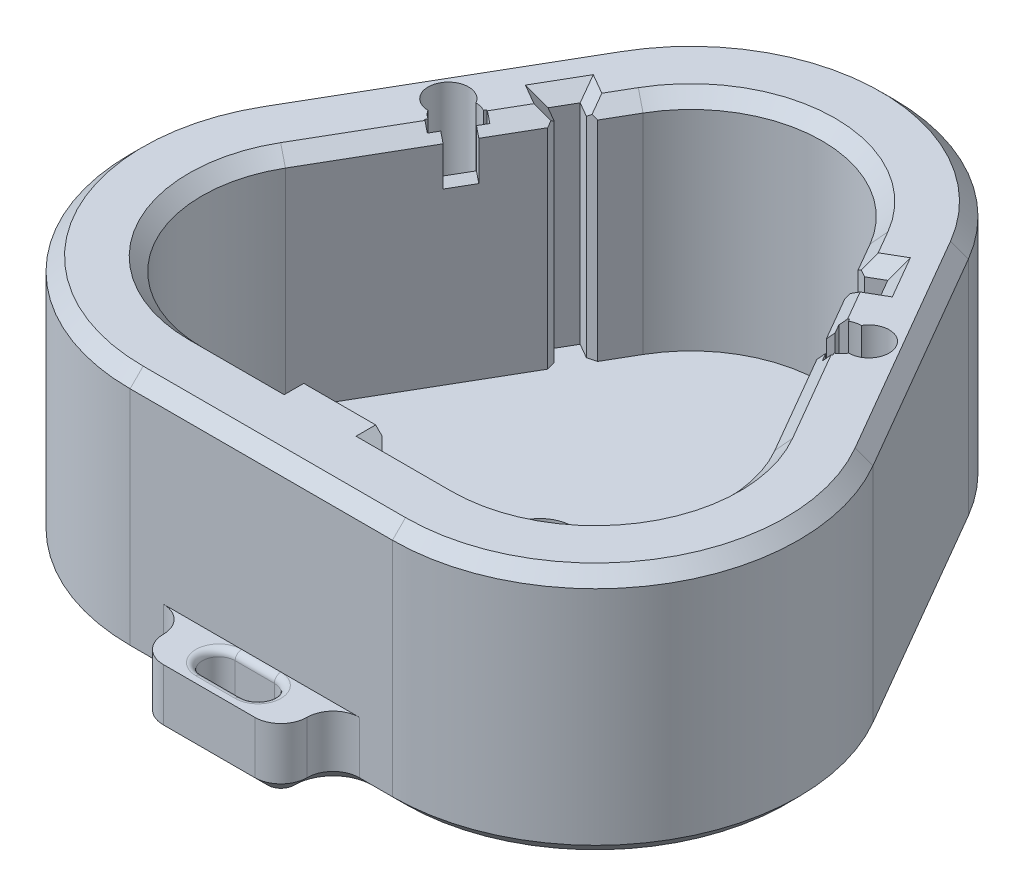
from build123d import *
from build123d.topology import SkipClean

# Parameters (mm, degrees)
BOSS_EXTRUDE1_DEPTH = 17
CHAMFER1_SIZE       = 0.5
BOSS_EXTRUDE2_START = -2
SKETCH1_4_R         = 1.55
BOSS_EXTRUDE2_DEPTH = 2
CUT_EXTRUDE2_REACH  = 43.817
SKETCH2_R           = 2.5
SKETCH2_2_W         = 11
SKETCH2_2_H         = 4
BOSS_EXTRUDE3_DEPTH = 5
FILLET1_R           = 2
FILLET2_R           = 0.5
CHAMFER4_SIZE       = 1
CUT_EXTRUDE3_DEPTH  = 3
CHAMFER5_SIZE       = 1
CHAMFER6_SIZE       = 0.5


# Some blends are built 0.0001 mm under size
with BuildPart() as part:
    # Sketch1 → Boss-Extrude1 (new body)
    with BuildSketch(Plane(origin=(0, 0, 0), x_dir=(1, 0, 0), z_dir=(0, 1, 0))):
        with BuildLine():
            ThreePointArc((13.443940814, 19.338496226), (0, 27.087942695), (-13.443940814, 19.338496226))
            Line((-13.443940814, 19.338496226), (-23.480112729, 2.010840056))
            ThreePointArc((-23.480112729, 2.010840056), (-23.496271152, -13.534646006), (-10.036171915, -21.312057305))
            Line((-10.036171915, -21.312057305), (10.036171915, -21.312057305))
            ThreePointArc((10.036171915, -21.312057305), (23.496271152, -13.534646006), (23.480112729, 2.010840056))
            Line((23.480112729, 2.010840056), (13.443940814, 19.338496226))
        make_face()
        with BuildLine():
            Line((-3.75, -15.312057305), (-3.75, -15.812057305))
            Line((-3.75, -15.812057305), (-10.036171915, -15.812057305))
            ThreePointArc((-10.036171915, -15.812057305), (-18.731226957, -10.787947294), (-18.720788818, -0.745758557))
            Line((-18.720788818, -0.745758557), (-11.1108823, 12.392900759))
            Line((-11.1108823, 12.392900759), (-12.668479216, 13.295060305))
            Line((-12.668479216, 13.295060305), (-11.76631967, 14.852657222))
            Line((-11.76631967, 14.852657222), (-10.208722754, 13.950497676))
            Line((-10.208722754, 13.950497676), (-8.684616903, 16.581897613))
            ThreePointArc((-8.684616903, 16.581897613), (0, 21.587942695), (8.684616903, 16.581897613))
            Line((8.684616903, 16.581897613), (10.208722754, 13.950497676))
            Line((10.208722754, 13.950497676), (11.76631967, 14.852657222))
            Line((11.76631967, 14.852657222), (12.668479216, 13.295060305))
            Line((12.668479216, 13.295060305), (11.1108823, 12.392900759))
            Line((11.1108823, 12.392900759), (18.720788818, -0.745758557))
            ThreePointArc((18.720788818, -0.745758557), (18.731226957, -10.787947294), (10.036171915, -15.812057305))
            Line((10.036171915, -15.812057305), (3.75, -15.812057305))
            Line((3.75, -15.812057305), (3.75, -15.312057305))
            Line((3.75, -15.312057305), (-3.75, -15.312057305))
        make_face(mode=Mode.SUBTRACT)
        with BuildLine():
            Line((-13.869325554, 9.825125784), (-13.350126582, 9.524405935))
            Line((-13.350126582, 9.524405935), (-15.104325699, 6.495745265))
            Line((-15.104325699, 6.495745265), (-15.623524672, 6.796465113))
            Line((-15.623524672, 6.796465113), (-15.523284722, 6.969531437))
            ThreePointArc((-15.523284722, 6.969531437), (-15.843958543, 7.216299963), (-16.089837275, 7.537656546))
            ThreePointArc((-16.089837275, 7.537656546), (-17.428953135, 9.864514667), (-14.744276962, 9.86079396))
            ThreePointArc((-14.744276962, 9.86079396), (-14.343181024, 9.807423059), (-13.969565504, 9.65205946))
            Line((-13.969565504, 9.65205946), (-13.869325554, 9.825125784))
        make_face(mode=Mode.SUBTRACT)
        with BuildLine():
            Line((13.869325554, 9.825125784), (13.969565504, 9.65205946))
            ThreePointArc((13.969565504, 9.65205946), (14.343181024, 9.807423059), (14.744276962, 9.86079396))
            ThreePointArc((14.744276962, 9.86079396), (17.428953135, 9.864514667), (16.089837275, 7.537656546))
            ThreePointArc((16.089837275, 7.537656546), (15.843958543, 7.216299963), (15.523284722, 6.969531437))
            Line((15.523284722, 6.969531437), (15.623524672, 6.796465113))
            Line((15.623524672, 6.796465113), (15.104325699, 6.495745265))
            Line((15.104325699, 6.495745265), (13.350126582, 9.524405935))
            Line((13.350126582, 9.524405935), (13.869325554, 9.825125784))
        make_face(mode=Mode.SUBTRACT)
    extrude(amount=BOSS_EXTRUDE1_DEPTH)

    # Chamfer1
    chamfer1_edges = [part.edges().sort_by_distance(p)[0] for p in [
        (-10.208722754, 8.5, -13.950497676),
        (-11.1108823, 8.5, -12.392900759),
        (11.1108823, 8.5, -12.392900759),
        (10.208722754, 8.5, -13.950497676),
    ]]
    chamfer(chamfer1_edges, length=CHAMFER1_SIZE)

    # Sketch1<4> → Boss-Extrude2 (add)
    with SkipClean():  # the faces are left unmerged after this step: merging them gives an invalid solid
        with BuildSketch(Plane(origin=(0, 0, 0), x_dir=(1, 0, 0), z_dir=(0, 1, 0)).offset(BOSS_EXTRUDE2_START)):
            with BuildLine():
                ThreePointArc((13.443940814, 19.338496226), (0, 27.087942695), (-13.443940814, 19.338496226))
                Line((-13.443940814, 19.338496226), (-23.480112729, 2.010840056))
                ThreePointArc((-23.480112729, 2.010840056), (-23.496271152, -13.534646006), (-10.036171915, -21.312057305))
                Line((-10.036171915, -21.312057305), (10.036171915, -21.312057305))
                ThreePointArc((10.036171915, -21.312057305), (23.496271152, -13.534646006), (23.480112729, 2.010840056))
                Line((23.480112729, 2.010840056), (13.443940814, 19.338496226))
            make_face()
            with Locations(Location((-16.087689124, 9.087655058, 0), (0, 0, 29.920593528))):
                Circle(SKETCH1_4_R, mode=Mode.SUBTRACT)
            with Locations(Location((16.087689124, 9.087655058, 0), (0, 0, 150.079406472))):
                Circle(SKETCH1_4_R, mode=Mode.SUBTRACT)
        extrude(amount=BOSS_EXTRUDE2_DEPTH)

    # Sketch2 → Cut-Extrude2 (cut, up to next)
    with BuildSketch(Plane.XZ.offset(2), mode=Mode.PRIVATE) as cut_extrude2_sk1:
        with Locations(Location((0, 0, 0), (0, 0, 270))):
            Circle(SKETCH2_R)
    cut_extrude2_tool1 = extrude(cut_extrude2_sk1.sketch, amount=-CUT_EXTRUDE2_REACH, mode=Mode.PRIVATE) & part.part
    add(cut_extrude2_tool1.solids().sort_by_distance((0, -2, 0))[0], mode=Mode.SUBTRACT)

    # Sketch2<2> → Boss-Extrude3 (add)
    with SkipClean():  # the faces are left unmerged after this step: merging them gives an invalid solid
        with BuildSketch(Plane.XZ.offset(2)):
            with Locations((0, 23.312057305)):
                Rectangle(SKETCH2_2_W, SKETCH2_2_H)
            with BuildLine():
                ThreePointArc((-1.5, 21.812057305), (-2.75, 23.062057305), (-1.5, 24.312057305))
                Line((-1.5, 24.312057305), (1.5, 24.312057305))
                ThreePointArc((1.5, 24.312057305), (2.75, 23.062057305), (1.5, 21.812057305))
                Line((1.5, 21.812057305), (-1.5, 21.812057305))
            make_face(mode=Mode.SUBTRACT)
        extrude(amount=-BOSS_EXTRUDE3_DEPTH)

    # Fillet1
    fillet1_edges = [part.edges().sort_by_distance(p)[0] for p in [
        (5.5, 1.5, 21.312057305),
        (-5.5, 1.5, 21.312057305),
        (-5.5, -1, 21.312057305),
        (5.5, -1, 21.312057305),
    ]]
    fillet(fillet1_edges, radius=FILLET1_R)
    fillet1_2_edges = [part.edges().sort_by_distance(p)[0] for p in [
        (5.5, 0.5, 25.312057305),
        (-5.5, 0.5, 25.312057305),
    ]]
    fillet(fillet1_2_edges, radius=FILLET1_R - 0.0001)  # a hair under: the kernel refuses the full size

    # Fillet2
    fillet2_edges = [part.edges().sort_by_distance(p)[0] for p in [
        (0, 3, 24.312057305),
        (2.75, 3, 23.062057305),
        (-2.75, 3, 23.062057305),
        (0, 3, 21.812057305),
    ]]
    fillet(fillet2_edges, radius=FILLET2_R - 0.0001)  # a hair under: the kernel refuses the full size

    # Chamfer4
    chamfer4_edges = [part.edges().sort_by_distance(p)[0] for p in [
        (0, -2, -27.087942695),
        (23.496271152, -2, 13.534646006),
        (-8.768085957, -2, 21.312057305),
        (-23.496271152, -2, 13.534646006),
        (-18.462026771, -2, -10.674668141),
        (18.462026771, -2, -10.674668141),
        (0, 17, 21.312057305),
        (23.496271152, 17, 13.534646006),
        (18.462026771, 17, -10.674668141),
        (0, 17, -27.087942695),
        (-18.462026771, 17, -10.674668141),
        (-23.496271152, 17, 13.534646006),
        (8.768085958, -2, 21.312057305),
        (0, -2, 25.312057305),
        (-4.914242852, -2, 24.726300157),
        (4.914242852, -2, 24.726300157),
        (6.085786438, -2, 21.897843743),
        (-6.085786438, -2, 21.897843743),
    ]]
    chamfer(chamfer4_edges, length=CHAMFER4_SIZE - 0.0001)  # a hair under: the kernel refuses the full size

    # Sketch3 → Cut-Extrude3 (cut)
    with SkipClean():  # the faces are left unmerged after this step: merging them gives an invalid solid
        with BuildSketch(Plane(origin=(0, 17, 0), x_dir=(1, 0, 0), z_dir=(0, 1, 0))):
            Polygon((-13.726026393, 8.87540722), (-13.293360583, 8.624807346), (-14.295760079, 6.894144106), (-14.728425889, 7.14474398), align=None)
            Polygon((14.728425889, 7.14474398), (13.726026393, 8.87540722), (13.293360583, 8.624807346), (14.295760079, 6.894144106), align=None)
        extrude(amount=-CUT_EXTRUDE3_DEPTH, mode=Mode.SUBTRACT)

    # Chamfer5
    # the kernel refuses this chamfer: 1 mm, written as the material it takes off along each edge
    with BuildSketch(Plane(origin=(13.293360583, 14, -8.624807346), x_dir=(-0.023793051453924997, -0.9996219169112968, 0.013780926423705212), z_dir=(0.5011997478341295, 0, 0.8653316201150892))) as chamfer5_piece_1:
        Polygon((CHAMFER5_SIZE * 0.999621916911, CHAMFER5_SIZE * 0.0274958766106), (-CHAMFER5_SIZE * 0.0274958766106, CHAMFER5_SIZE * 0.999621916911), (0, 0), align=None)
    extrude(amount=2, mode=Mode.SUBTRACT)
    with BuildSketch(Plane(origin=(-13.293360583, 14, -8.624807346), x_dir=(0.023793051453929074, -0.9996219169112965, 0.013780926423707577), z_dir=(-0.5011997478341295, 0, 0.8653316201150892))) as chamfer5_piece_2:
        Polygon((CHAMFER5_SIZE * 0.999621916911, -CHAMFER5_SIZE * 0.0274958766106), (-CHAMFER5_SIZE * 0.0274958766106, -CHAMFER5_SIZE * 0.999621916911), (0, 0), align=None)
    extrude(amount=2, mode=Mode.SUBTRACT)
    with BuildSketch(Plane(origin=(8.416029957, 17, -12.912170684), x_dir=(0.013780926423704562, -0.9996219169112968, 0.023793051453923648), z_dir=(0.8653316201150872, 0, -0.501199747834133)), Plane(origin=(12.668479216, 17, -13.295060305), x_dir=(-0.013780926423704508, -0.9996219169112968, -0.02379305145392368), z_dir=(-0.8653316201150884, 0, 0.501199747834131)), Plane(origin=(-9.318189504, 17, -11.354573768), x_dir=(0.013780926423704508, -0.9996219169112968, -0.02379305145392368), z_dir=(-0.8653316201150884, 0, -0.501199747834131)), Plane(origin=(-11.76631967, 17, -14.852657222), x_dir=(-0.013780926423704518, -0.9996219169112968, 0.023793051453923672), z_dir=(0.8653316201150881, 0, 0.5011997478341315))) as chamfer5_piece_3:
        Polygon((CHAMFER5_SIZE * 0.999621916911, CHAMFER5_SIZE * 0.0274958766106), (-CHAMFER5_SIZE * 0.0274958766106, CHAMFER5_SIZE * 0.999621916911), (0, 0), align=None)
    extrude(amount=3.871682988, mode=Mode.SUBTRACT)
    with BuildSketch(Plane(origin=(11.76631967, 17, -14.852657222), x_dir=(-0.023793051453923655, -0.9996219169112968, 0.013780926423704546), z_dir=(0.5011997478341325, 0, 0.8653316201150876)), Plane(origin=(-12.668479216, 17, -13.295060305), x_dir=(0.02379305145392368, -0.9996219169112968, 0.013780926423704508), z_dir=(0.501199747834131, 0, -0.8653316201150884))) as chamfer5_piece_4:
        Polygon((CHAMFER5_SIZE * 0.999621916911, CHAMFER5_SIZE * 0.0274958766106), (-CHAMFER5_SIZE * 0.0274958766106, CHAMFER5_SIZE * 0.999621916911), (0, 0), align=None)
    extrude(amount=1.8, mode=Mode.SUBTRACT)
    with BuildSketch(Plane(origin=(10.072555309, 17, -14.185593556), x_dir=(-0.023793051453924238, -0.9996219169112968, 0.013780926423704794), z_dir=(0.50119974783413, 0, 0.8653316201150889)), Plane(origin=(-14.582287448, 17, -6.39944874), x_dir=(0.0237930514539237, -0.9996219169112968, 0.013780926423704468), z_dir=(0.5011997478341296, 0, -0.8653316201150891))) as chamfer5_piece_5:
        Polygon((CHAMFER5_SIZE * 0.999621916911, CHAMFER5_SIZE * 0.0274958766106), (-CHAMFER5_SIZE * 0.0274958766106, CHAMFER5_SIZE * 0.999621916911), (0, 0), align=None)
    extrude(amount=8.997873919, mode=Mode.SUBTRACT)
    with BuildSketch(Plane(origin=(13.006833213, 17, -9.119502712), x_dir=(-0.023793051453922947, -0.9996219169112968, 0.013780926423704046), z_dir=(0.50119974783413, 0, 0.8653316201150889)), Plane(origin=(-18.720788818, 17, 0.745758557), x_dir=(0.0237930514539225, -0.9996219169112968, 0.013780926423703772), z_dir=(0.5011997478341296, 0, -0.8653316201150891))) as chamfer5_piece_6:
        Polygon((CHAMFER5_SIZE * 0.999621916911, CHAMFER5_SIZE * 0.0274958766106), (-CHAMFER5_SIZE * 0.0274958766106, CHAMFER5_SIZE * 0.999621916911), (0, 0), align=None)
    extrude(amount=11.400555625, mode=Mode.SUBTRACT)
    with BuildSketch(Plane(origin=(10.036171915, 17, 5.77588539), x_dir=(0.8653316201150898, 0, -0.5011997478341286), z_dir=(-0.5011997478341286, 0, -0.8653316201150898))) as chamfer5_piece_7:
        Polygon((10.036171915, CHAMFER5_SIZE), (10.036171915 + CHAMFER5_SIZE, 0), (10.036171915, 0), align=None)
    revolve(axis=Axis((10.036171915, 17, 5.77588539), (0, -1, 0)), revolution_arc=120.079406472, mode=Mode.SUBTRACT)
    with BuildSketch(Plane(origin=(10.036171915, 17, 15.812057305), x_dir=(0, -0.9996219169112968, -0.027495876610585647), z_dir=(-1, 0, 0)), Plane(origin=(-3.75, 17, 15.812057305), x_dir=(0, -0.9996219169112968, -0.027495876610585647), z_dir=(-1, 0, 0))) as chamfer5_piece_8:
        Polygon((CHAMFER5_SIZE * 0.999621916911, CHAMFER5_SIZE * 0.0274958766106), (-CHAMFER5_SIZE * 0.0274958766106, CHAMFER5_SIZE * 0.999621916911), (0, 0), align=None)
    extrude(amount=6.286171915, mode=Mode.SUBTRACT)
    with BuildSketch(Plane(origin=(3.75, 17, 15.812057305), x_dir=(0.02749587661058651, -0.9996219169112968, 0), z_dir=(0, 0, -1)), Plane(origin=(-3.75, 17, 12.740374317), x_dir=(-0.02749587661058651, -0.9996219169112968, 0), z_dir=(0, 0, 1))) as chamfer5_piece_9:
        Polygon((CHAMFER5_SIZE * 0.999621916911, CHAMFER5_SIZE * 0.0274958766106), (-CHAMFER5_SIZE * 0.0274958766106, CHAMFER5_SIZE * 0.999621916911), (0, 0), align=None)
    extrude(amount=3.071682988, mode=Mode.SUBTRACT)
    with BuildSketch(Plane(origin=(-10.036171915, 17, 5.77588539), x_dir=(0, 0, 1), z_dir=(1, 0, 0))) as chamfer5_piece_10:
        Polygon((10.036171915, CHAMFER5_SIZE), (10.036171915 + CHAMFER5_SIZE, 0), (10.036171915, 0), align=None)
    revolve(axis=Axis((-10.036171915, 17, 5.77588539), (0, -1, 0)), revolution_arc=120.079406472, mode=Mode.SUBTRACT)
    with BuildSketch(Plane(origin=(8.684616903, 17, -16.581897613), x_dir=(-0.023793051453924442, -0.9996219169112968, 0.01378092642370491), z_dir=(0.5011997478341299, 0, 0.8653316201150889)), Plane(origin=(-11.247049745, 17, -12.157804879), x_dir=(0.023793051453922406, -0.9996219169112968, 0.013780926423703719), z_dir=(0.5011997478341296, 0, -0.8653316201150891))) as chamfer5_piece_11:
        Polygon((CHAMFER5_SIZE * 0.999621916911, CHAMFER5_SIZE * 0.0274958766106), (-CHAMFER5_SIZE * 0.0274958766106, CHAMFER5_SIZE * 0.999621916911), (0, 0), align=None)
    extrude(amount=5.112598027, mode=Mode.SUBTRACT)
    with BuildSketch(Plane(origin=(0, 17, -11.55177078), x_dir=(-0.8653316201150889, 0, -0.5011997478341299), z_dir=(-0.5011997478341299, 0, 0.8653316201150889))) as chamfer5_piece_12:
        Polygon((10.036171915, CHAMFER5_SIZE), (10.036171915 + CHAMFER5_SIZE, 0), (10.036171915, 0), align=None)
    revolve(axis=Axis((0, 17, -11.55177078), (0, -1, 0)), revolution_arc=119.841187056, mode=Mode.SUBTRACT)
    with BuildSketch(Plane(origin=(8.416029957, 17, -12.912170684), x_dir=(0.013780926423704562, -0.9996219169112968, 0.023793051453923648), z_dir=(0.8653316201150872, 0, -0.501199747834133))) as chamfer5_piece_13a_section:
        Polygon((CHAMFER5_SIZE * 0.999621916911, CHAMFER5_SIZE * 0.0274958766106), (-CHAMFER5_SIZE * 0.0274958766106, CHAMFER5_SIZE * 0.999621916911), (0, 0), align=None)
    chamfer5_piece_13a = extrude(amount=6.443365976, mode=Mode.PRIVATE)
    chamfer5_piece_13a = split(chamfer5_piece_13a, bisect_by=Plane(origin=(11.601027187, 16.670206373, -15.138038075), z_dir=(0.8653316201150876, 0, -0.5011997478341325)), keep=Keep.TOP, mode=Mode.PRIVATE)
    with BuildSketch(Plane(origin=(10.477392805, 17, -17.078015828), x_dir=(-0.023793051453924404, -0.9996219169112968, 0.01378092642370498), z_dir=(0.5011997478341325, 0, 0.8653316201150876))) as chamfer5_piece_13b_section:
        Polygon((CHAMFER5_SIZE * 0.999621916911, CHAMFER5_SIZE * 0.0274958766106), (-CHAMFER5_SIZE * 0.0274958766106, CHAMFER5_SIZE * 0.999621916911), (0, 0), align=None)
    chamfer5_piece_13b = extrude(amount=4.371682988, mode=Mode.PRIVATE)
    chamfer5_piece_13b = split(chamfer5_piece_13b, bisect_by=Plane(origin=(12.051700523, 16.670206373, -15.017949704), z_dir=(-0.501199747834133, 0, -0.8653316201150872)), keep=Keep.TOP, mode=Mode.PRIVATE)
    chamfer5_piece_13 = chamfer5_piece_13a & chamfer5_piece_13b
    add(chamfer5_piece_13, mode=Mode.SUBTRACT)
    with BuildSketch(Plane(origin=(11.76631967, 17, -14.852657222), x_dir=(-0.023793051453923655, -0.9996219169112968, 0.013780926423704546), z_dir=(0.5011997478341325, 0, 0.8653316201150876))) as chamfer5_piece_14a_section:
        Polygon((CHAMFER5_SIZE * 0.999621916911, CHAMFER5_SIZE * 0.0274958766106), (-CHAMFER5_SIZE * 0.0274958766106, CHAMFER5_SIZE * 0.999621916911), (0, 0), align=None)
    chamfer5_piece_14a = extrude(amount=4.371682988, mode=Mode.PRIVATE)
    chamfer5_piece_14a = split(chamfer5_piece_14a, bisect_by=Plane(origin=(12.953860069, 16.670206373, -13.460352788), z_dir=(0.501199747834131, 0, 0.8653316201150884)), keep=Keep.TOP, mode=Mode.PRIVATE)
    with BuildSketch(Plane(origin=(14.893837822, 17, -14.58398717), x_dir=(-0.013780926423704508, -0.9996219169112968, -0.02379305145392368), z_dir=(-0.8653316201150884, 0, 0.501199747834131))) as chamfer5_piece_14b_section:
        Polygon((CHAMFER5_SIZE * 0.999621916911, CHAMFER5_SIZE * 0.0274958766106), (-CHAMFER5_SIZE * 0.0274958766106, CHAMFER5_SIZE * 0.999621916911), (0, 0), align=None)
    chamfer5_piece_14b = extrude(amount=6.443365976, mode=Mode.PRIVATE)
    chamfer5_piece_14b = split(chamfer5_piece_14b, bisect_by=Plane(origin=(12.833771699, 16.670206373, -13.009679452), z_dir=(0.8653316201150876, 0, -0.5011997478341325)), keep=Keep.TOP, mode=Mode.PRIVATE)
    chamfer5_piece_14 = chamfer5_piece_14a & chamfer5_piece_14b
    add(chamfer5_piece_14, mode=Mode.SUBTRACT)
    with BuildSketch(Plane(origin=(3.75, 17, 18.383740293), x_dir=(0.02749587661058651, -0.9996219169112968, 0), z_dir=(0, 0, -1))) as chamfer5_piece_15a_section:
        Polygon((CHAMFER5_SIZE * 0.999621916911, CHAMFER5_SIZE * 0.0274958766106), (-CHAMFER5_SIZE * 0.0274958766106, CHAMFER5_SIZE * 0.999621916911), (0, 0), align=None)
    chamfer5_piece_15a = extrude(amount=5.643365976, mode=Mode.PRIVATE)
    chamfer5_piece_15a = split(chamfer5_piece_15a, bisect_by=Plane(origin=(3.420206373, 16.670206373, 15.812057305), z_dir=(0, 0, 1)), keep=Keep.TOP, mode=Mode.PRIVATE)
    with BuildSketch(Plane(origin=(10.036171915, 17, 15.812057305), x_dir=(0, -0.9996219169112968, -0.027495876610585647), z_dir=(-1, 0, 0))) as chamfer5_piece_15b_section:
        Polygon((CHAMFER5_SIZE * 0.999621916911, CHAMFER5_SIZE * 0.0274958766106), (-CHAMFER5_SIZE * 0.0274958766106, CHAMFER5_SIZE * 0.999621916911), (0, 0), align=None)
    chamfer5_piece_15b = extrude(amount=8.857854903, mode=Mode.PRIVATE)
    chamfer5_piece_15b = split(chamfer5_piece_15b, bisect_by=Plane(origin=(3.75, 16.670206373, 16.141850932), z_dir=(-1, 0, 0)), keep=Keep.TOP, mode=Mode.PRIVATE)
    chamfer5_piece_15 = chamfer5_piece_15a & chamfer5_piece_15b
    add(chamfer5_piece_15, mode=Mode.SUBTRACT)
    with BuildSketch(Plane(origin=(-1.178317012, 17, 15.812057305), x_dir=(0, -0.9996219169112968, -0.027495876610585647), z_dir=(-1, 0, 0))) as chamfer5_piece_16a_section:
        Polygon((CHAMFER5_SIZE * 0.999621916911, CHAMFER5_SIZE * 0.0274958766106), (-CHAMFER5_SIZE * 0.0274958766106, CHAMFER5_SIZE * 0.999621916911), (0, 0), align=None)
    chamfer5_piece_16a = extrude(amount=8.857854903, mode=Mode.PRIVATE)
    chamfer5_piece_16a = split(chamfer5_piece_16a, bisect_by=Plane(origin=(-3.75, 16.670206373, 16.141850932), z_dir=(1, 0, 0)), keep=Keep.TOP, mode=Mode.PRIVATE)
    with BuildSketch(Plane(origin=(-3.75, 17, 12.740374317), x_dir=(-0.02749587661058651, -0.9996219169112968, 0), z_dir=(0, 0, 1))) as chamfer5_piece_16b_section:
        Polygon((CHAMFER5_SIZE * 0.999621916911, CHAMFER5_SIZE * 0.0274958766106), (-CHAMFER5_SIZE * 0.0274958766106, CHAMFER5_SIZE * 0.999621916911), (0, 0), align=None)
    chamfer5_piece_16b = extrude(amount=5.643365976, mode=Mode.PRIVATE)
    chamfer5_piece_16b = split(chamfer5_piece_16b, bisect_by=Plane(origin=(-3.420206373, 16.670206373, 15.812057305), z_dir=(0, 0, 1)), keep=Keep.TOP, mode=Mode.PRIVATE)
    chamfer5_piece_16 = chamfer5_piece_16a & chamfer5_piece_16b
    add(chamfer5_piece_16, mode=Mode.SUBTRACT)
    with BuildSketch(Plane(origin=(-9.318189504, 17, -11.354573768), x_dir=(0.013780926423704508, -0.9996219169112968, -0.02379305145392368), z_dir=(-0.8653316201150884, 0, -0.501199747834131))) as chamfer5_piece_17a_section:
        Polygon((CHAMFER5_SIZE * 0.999621916911, CHAMFER5_SIZE * 0.0274958766106), (-CHAMFER5_SIZE * 0.0274958766106, CHAMFER5_SIZE * 0.999621916911), (0, 0), align=None)
    chamfer5_piece_17a = extrude(amount=6.443365976, mode=Mode.PRIVATE)
    chamfer5_piece_17a = split(chamfer5_piece_17a, bisect_by=Plane(origin=(-12.833771699, 16.670206373, -13.009679452), z_dir=(-0.8653316201150884, 0, -0.501199747834131)), keep=Keep.TOP, mode=Mode.PRIVATE)
    with BuildSketch(Plane(origin=(-13.957406081, 17, -11.069701699), x_dir=(0.02379305145392368, -0.9996219169112968, 0.013780926423704508), z_dir=(0.501199747834131, 0, -0.8653316201150884))) as chamfer5_piece_17b_section:
        Polygon((CHAMFER5_SIZE * 0.999621916911, CHAMFER5_SIZE * 0.0274958766106), (-CHAMFER5_SIZE * 0.0274958766106, CHAMFER5_SIZE * 0.999621916911), (0, 0), align=None)
    chamfer5_piece_17b = extrude(amount=4.371682988, mode=Mode.PRIVATE)
    chamfer5_piece_17b = split(chamfer5_piece_17b, bisect_by=Plane(origin=(-12.953860069, 16.670206373, -13.460352788), z_dir=(-0.501199747834131, 0, 0.8653316201150884)), keep=Keep.TOP, mode=Mode.PRIVATE)
    chamfer5_piece_17 = chamfer5_piece_17a & chamfer5_piece_17b
    add(chamfer5_piece_17, mode=Mode.SUBTRACT)
    with BuildSketch(Plane(origin=(-12.668479216, 17, -13.295060305), x_dir=(0.02379305145392368, -0.9996219169112968, 0.013780926423704508), z_dir=(0.501199747834131, 0, -0.8653316201150884))) as chamfer5_piece_18a_section:
        Polygon((CHAMFER5_SIZE * 0.999621916911, CHAMFER5_SIZE * 0.0274958766106), (-CHAMFER5_SIZE * 0.0274958766106, CHAMFER5_SIZE * 0.999621916911), (0, 0), align=None)
    chamfer5_piece_18a = extrude(amount=4.371682988, mode=Mode.PRIVATE)
    chamfer5_piece_18a = split(chamfer5_piece_18a, bisect_by=Plane(origin=(-12.051700523, 16.670206373, -15.017949704), z_dir=(0.5011997478341315, 0, -0.8653316201150881)), keep=Keep.TOP, mode=Mode.PRIVATE)
    with BuildSketch(Plane(origin=(-13.991678276, 17, -16.141584087), x_dir=(-0.01378092642370314, -0.9996219169112968, 0.02379305145392129), z_dir=(0.8653316201150881, 0, 0.5011997478341315))) as chamfer5_piece_18b_section:
        Polygon((CHAMFER5_SIZE * 0.999621916911, CHAMFER5_SIZE * 0.0274958766106), (-CHAMFER5_SIZE * 0.0274958766106, CHAMFER5_SIZE * 0.999621916911), (0, 0), align=None)
    chamfer5_piece_18b = extrude(amount=6.443365976, mode=Mode.PRIVATE)
    chamfer5_piece_18b = split(chamfer5_piece_18b, bisect_by=Plane(origin=(-11.601027187, 16.670206373, -15.138038075), z_dir=(-0.8653316201150884, 0, -0.501199747834131)), keep=Keep.TOP, mode=Mode.PRIVATE)
    chamfer5_piece_18 = chamfer5_piece_18a & chamfer5_piece_18b
    add(chamfer5_piece_18, mode=Mode.SUBTRACT)

    # Chamfer6
    chamfer6_edges = [part.edges().sort_by_distance(p)[0] for p in [
        (3.75, 8, 15.312057305),
        (-3.75, 8, 15.312057305),
    ]]
    chamfer(chamfer6_edges, length=CHAMFER6_SIZE - 0.0001)  # a hair under: the kernel refuses the full size


solid = part.part
